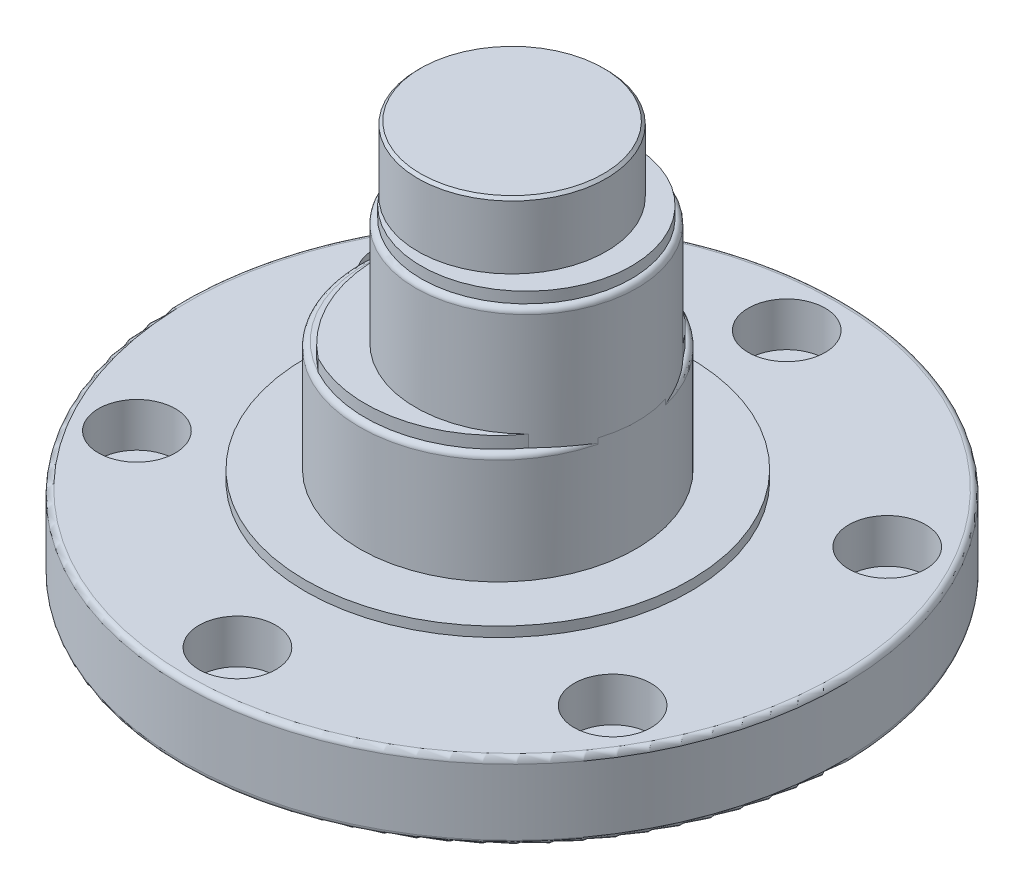
from build123d import *

# Parameters (mm, degrees)
SKETCH1_R           = 30
SKETCH1_R_2         = 2.05
BOSS_EXTRUDE1_DEPTH = 7
SKETCH2_R           = 12.575
BOSS_EXTRUDE2_DEPTH = 11
SKETCH3_R           = 10.075
BOSS_EXTRUDE3_DEPTH = 11
FILLET1_R           = 0.5
SKETCH4_R           = 3.5
CUT_EXTRUDE1_DEPTH  = 4
SKETCH5_R           = 8.575
BOSS_EXTRUDE4_DEPTH = 7
SKETCH6_R           = 17.5
SKETCH6_R_2         = 12.575
BOSS_EXTRUDE5_DEPTH = 0.9
BOSS_EXTRUDE6_DEPTH = 1.1
CHAMFER1_SIZE       = 0.25
BOSS_EXTRUDE7_DEPTH = 1


with BuildPart() as part:
    # Sketch1 → Boss-Extrude1 (new body)
    with BuildSketch(Plane(origin=(0, 0, 0), x_dir=(1, 0, 0), z_dir=(0, 1, 0))):
        Circle(SKETCH1_R)
        with Locations((0, 25)):
            Circle(SKETCH1_R_2, mode=Mode.SUBTRACT)
        with Locations((21.650635095, 12.5)):
            Circle(SKETCH1_R_2, mode=Mode.SUBTRACT)
        with Locations((21.650635095, -12.5)):
            Circle(SKETCH1_R_2, mode=Mode.SUBTRACT)
        with Locations((0, -25)):
            Circle(SKETCH1_R_2, mode=Mode.SUBTRACT)
        with Locations((-21.650635095, -12.5)):
            Circle(SKETCH1_R_2, mode=Mode.SUBTRACT)
        with Locations((-21.650635095, 12.5)):
            Circle(SKETCH1_R_2, mode=Mode.SUBTRACT)
    extrude(amount=BOSS_EXTRUDE1_DEPTH)

    # Sketch2 → Boss-Extrude2 (add)
    with BuildSketch(Plane(origin=(0, 7, 0), x_dir=(1, 0, 0), z_dir=(0, 1, 0))):
        with Locations((-1.3, 0)):
            Circle(SKETCH2_R)
    extrude(amount=BOSS_EXTRUDE2_DEPTH)

    # Sketch3 → Boss-Extrude3 (add)
    with BuildSketch(Plane(origin=(0, 18, 0), x_dir=(1, 0, 0), z_dir=(0, 1, 0))):
        with Locations((1.3, 0)):
            Circle(SKETCH3_R)
    extrude(amount=BOSS_EXTRUDE3_DEPTH)

    # Fillet1
    fillet1_edges = [part.edges().sort_by_distance(p)[0] for p in [
        (-8.775, 29, 0),
        (-13.875, 18, 0),
        (-30, 0, 0),
        (-30, 7, 0),
    ]]
    fillet(fillet1_edges, radius=FILLET1_R)

    # Sketch4 → Cut-Extrude1 (cut)
    with BuildSketch(Plane(origin=(0, 7, 0), x_dir=(1, 0, 0), z_dir=(0, 1, 0))):
        with Locations((0, 25)):
            Circle(SKETCH4_R)
        with Locations((21.650635095, 12.5)):
            Circle(SKETCH4_R)
        with Locations((21.650635095, -12.5)):
            Circle(SKETCH4_R)
        with Locations((0, -25)):
            Circle(SKETCH4_R)
        with Locations((-21.650635095, -12.5)):
            Circle(SKETCH4_R)
        with Locations((-21.650635095, 12.5)):
            Circle(SKETCH4_R)
    extrude(amount=-CUT_EXTRUDE1_DEPTH, mode=Mode.SUBTRACT)

    # Sketch5 → Boss-Extrude4 (add)
    with BuildSketch(Plane(origin=(0, 29, 0), x_dir=(1, 0, 0), z_dir=(0, 1, 0))):
        Circle(SKETCH5_R)
    extrude(amount=BOSS_EXTRUDE4_DEPTH)

    # Sketch6 → Boss-Extrude5 (add)
    with BuildSketch(Plane(origin=(0, 7, 0), x_dir=(1, 0, 0), z_dir=(0, 1, 0))):
        with Locations((-1.3, 0)):
            Circle(SKETCH6_R)
        with Locations((-1.3, 0)):
            Circle(SKETCH6_R_2, mode=Mode.SUBTRACT)
    extrude(amount=BOSS_EXTRUDE5_DEPTH)

    # Sketch7 → Boss-Extrude6 (add)
    with BuildSketch(Plane(origin=(0, 18, 0), x_dir=(1, 0, 0), z_dir=(0, 1, 0))):
        with BuildLine():
            ThreePointArc((8.519230769, -7.027683267), (-8.775, 0), (8.519230769, 7.027683267))
            ThreePointArc((8.519230769, 7.027683267), (1.436311663, 11.760876816), (-7.008533654, 10.640407348))
            ThreePointArc((-7.008533654, 10.640407348), (-12.2, 0), (-7.008533654, -10.640407348))
            ThreePointArc((-7.008533654, -10.640407348), (1.436311663, -11.760876816), (8.519230769, -7.027683267))
        make_face()
    extrude(amount=BOSS_EXTRUDE6_DEPTH)

    # Chamfer1
    chamfer1_edges = [part.edges().sort_by_distance(p)[0] for p in [
        (-8.575, 36, 0),
    ]]
    chamfer(chamfer1_edges, length=CHAMFER1_SIZE)

    # Sketch8 → Boss-Extrude7 (add)
    with BuildSketch(Plane(origin=(0, 29, 0), x_dir=(1, 0, 0), z_dir=(0, 1, 0))):
        with BuildLine():
            ThreePointArc((-6.330769231, 5.783769182), (3.101957354, 7.994278302), (8.575, 0))
            ThreePointArc((8.575, 0), (3.101957354, -7.994278302), (-6.330769231, -5.783769182))
            ThreePointArc((-6.330769231, -5.783769182), (10.875, 0), (-6.330769231, 5.783769182))
        make_face()
    extrude(amount=BOSS_EXTRUDE7_DEPTH)


solid = part.part
